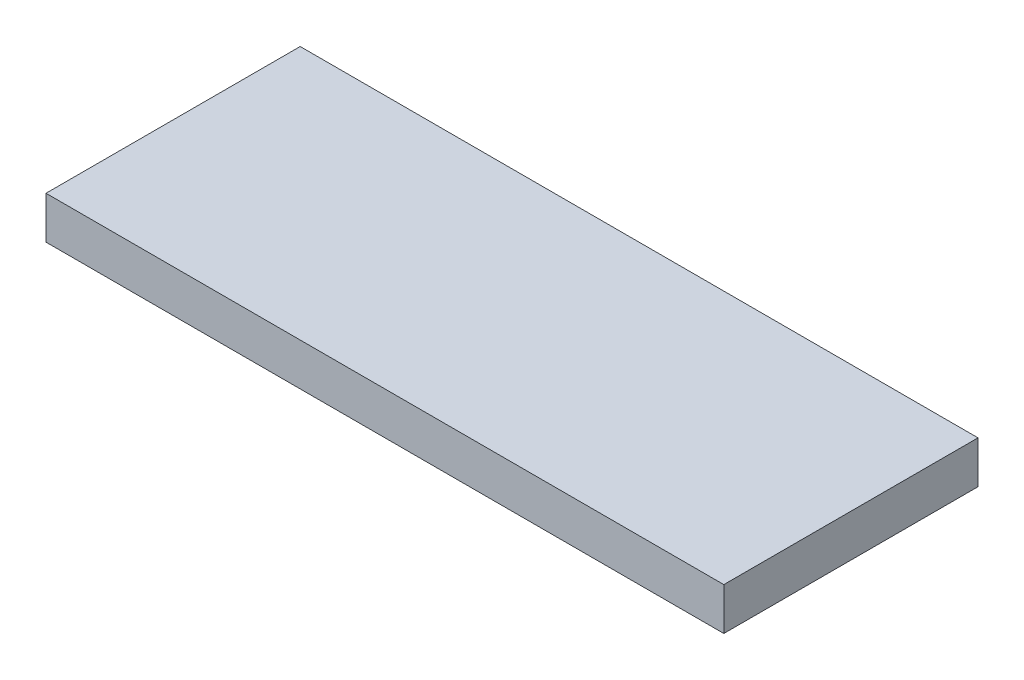
from build123d import *

# Parameters (mm, degrees)
SKETCH1_W           = 160
SKETCH1_H           = 60
BOSS_EXTRUDE1_DEPTH = 10


with BuildPart() as part:
    # Sketch1 → Boss-Extrude1 (new body)
    with BuildSketch(Plane(origin=(0, 0, 0), x_dir=(1, 0, 0), z_dir=(0, 1, 0))):
        Rectangle(SKETCH1_W, SKETCH1_H)
    extrude(amount=-BOSS_EXTRUDE1_DEPTH)


solid = part.part
